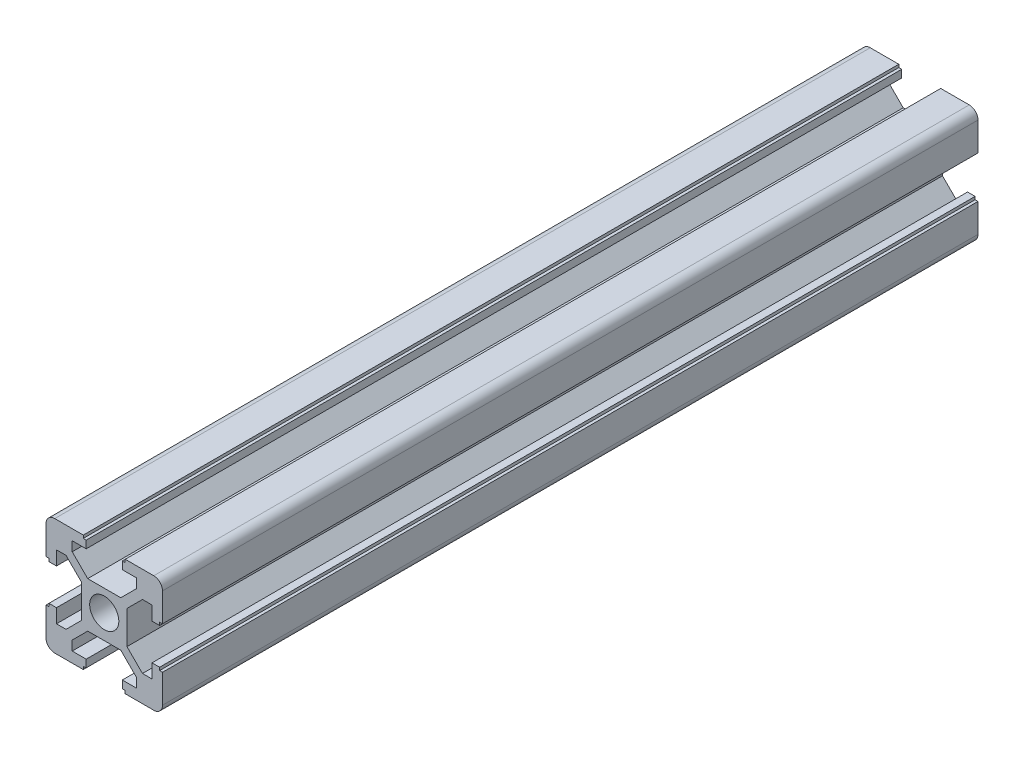
from build123d import *

# Parameters (mm, degrees)
SKETCH1_R           = 2.5
BOSS_EXTRUDE1_DEPTH = 140
SCALE_2_SCALE       = 3
SCALE_3_SCALE       = 6
SCALE_5_SCALE       = 2
SCALE_6_SCALE       = 0.25
SCALE_7_SCALE       = 0.125
SCALE_8_SCALE       = 0.25
SCALE_9_SCALE       = 4
SCALE_10_SCALE      = 4
OTHER_START         = -17.55
OTHER_1_OUTLINE_R   = 5
OTHER_1_DEPTH       = 10
SCALE_11_SCALE      = 0.111111111


# Read off the part's stored shape, not the designer's step: 孔1
with BuildPart() as part:
    # Sketch1 → Boss-Extrude1 (new body)
    with BuildSketch(Plane.XY):
        with BuildLine():
            Line((2.839339828, 3.9), (5.5, 6.560660172))
            Line((5.5, 6.560660172), (5.5, 8.2))
            Line((5.5, 8.2), (3.1, 8.2))
            Line((3.1, 8.2), (3.1, 9.5))
            Line((3.1, 9.5), (3.6, 9.5))
            Line((3.6, 9.5), (3.6, 10))
            Line((3.6, 10), (8.5, 10))
            ThreePointArc((8.5, 10), (9.560660172, 9.560660172), (10, 8.5))
            Line((10, 8.5), (10, 3.6))
            Line((10, 3.6), (9.5, 3.6))
            Line((9.5, 3.6), (9.5, 3.1))
            Line((9.5, 3.1), (8.2, 3.1))
            Line((8.2, 3.1), (8.2, 5.5))
            Line((8.2, 5.5), (6.560660172, 5.5))
            Line((6.560660172, 5.5), (3.9, 2.839339828))
            Line((3.9, 2.839339828), (3.9, -2.839339828))
            Line((3.9, -2.839339828), (6.560660172, -5.5))
            Line((6.560660172, -5.5), (8.2, -5.5))
            Line((8.2, -5.5), (8.2, -3.1))
            Line((8.2, -3.1), (9.5, -3.1))
            Line((9.5, -3.1), (9.5, -3.6))
            Line((9.5, -3.6), (10, -3.6))
            Line((10, -3.6), (10, -8.5))
            ThreePointArc((10, -8.5), (9.560660172, -9.560660172), (8.5, -10))
            Line((8.5, -10), (3.6, -10))
            Line((3.6, -10), (3.6, -9.5))
            Line((3.6, -9.5), (3.1, -9.5))
            Line((3.1, -9.5), (3.1, -8.2))
            Line((3.1, -8.2), (5.5, -8.2))
            Line((5.5, -8.2), (5.5, -6.560660172))
            Line((5.5, -6.560660172), (2.839339828, -3.9))
            Line((2.839339828, -3.9), (-2.839339828, -3.9))
            Line((-2.839339828, -3.9), (-5.5, -6.560660172))
            Line((-5.5, -6.560660172), (-5.5, -8.2))
            Line((-5.5, -8.2), (-3.1, -8.2))
            Line((-3.1, -8.2), (-3.1, -9.5))
            Line((-3.1, -9.5), (-3.6, -9.5))
            Line((-3.6, -9.5), (-3.6, -10))
            Line((-3.6, -10), (-8.5, -10))
            ThreePointArc((-8.5, -10), (-9.560660172, -9.560660172), (-10, -8.5))
            Line((-10, -8.5), (-10, -3.6))
            Line((-10, -3.6), (-9.5, -3.6))
            Line((-9.5, -3.6), (-9.5, -3.1))
            Line((-9.5, -3.1), (-8.2, -3.1))
            Line((-8.2, -3.1), (-8.2, -5.5))
            Line((-8.2, -5.5), (-6.560660172, -5.5))
            Line((-6.560660172, -5.5), (-3.9, -2.839339828))
            Line((-3.9, -2.839339828), (-3.9, 2.839339828))
            Line((-3.9, 2.839339828), (-6.560660172, 5.5))
            Line((-6.560660172, 5.5), (-8.2, 5.5))
            Line((-8.2, 5.5), (-8.2, 3.1))
            Line((-8.2, 3.1), (-9.5, 3.1))
            Line((-9.5, 3.1), (-9.5, 3.6))
            Line((-9.5, 3.6), (-10, 3.6))
            Line((-10, 3.6), (-10, 8.5))
            ThreePointArc((-10, 8.5), (-9.560660172, 9.560660172), (-8.5, 10))
            Line((-8.5, 10), (-3.6, 10))
            Line((-3.6, 10), (-3.6, 9.5))
            Line((-3.6, 9.5), (-3.1, 9.5))
            Line((-3.1, 9.5), (-3.1, 8.2))
            Line((-3.1, 8.2), (-5.5, 8.2))
            Line((-5.5, 8.2), (-5.5, 6.560660172))
            Line((-5.5, 6.560660172), (-2.839339828, 3.9))
            Line((-2.839339828, 3.9), (2.839339828, 3.9))
        make_face()
        with Locations((0, 0.235847297)):
            Circle(SKETCH1_R, mode=Mode.SUBTRACT)
    extrude(amount=BOSS_EXTRUDE1_DEPTH)


with BuildPart() as part_1:
    # 缩放比例2: scaled about (0, -0.027095247, 70)
    add(part.part.scale(SCALE_2_SCALE).moved(Location((0, 0.054190494, -140))))


with BuildPart() as part_2:
    # 缩放比例3: scaled about (0, -0.027095247, 70)
    add(part_1.part.scale(SCALE_3_SCALE).moved(Location((0, 0.135476235, -350))))


with BuildPart() as part_3:
    # 缩放比例5: scaled about (0, -0.027095249, 70)
    add(part_2.part.scale(SCALE_5_SCALE).moved(Location((0, 0.027095249, -70))))


with BuildPart() as part_4:
    # 缩放比例6: scaled about (0, -0.027095249, 70)
    add(part_3.part.scale(SCALE_6_SCALE).moved(Location((0, -0.020321437, 52.5))))


with BuildPart() as part_5:
    # 缩放比例7: scaled about (0, -0.027095249, 70)
    add(part_4.part.scale(SCALE_7_SCALE).moved(Location((0, -0.023708343, 61.25))))


with BuildPart() as part_6:
    # 缩放比例8: scaled about (0, -0.027095249, 70)
    add(part_5.part.scale(SCALE_8_SCALE).moved(Location((0, -0.020321437, 52.5))))


with BuildPart() as part_7:
    # 缩放比例9: scaled about (0, -0.027095249, 70)
    add(part_6.part.scale(SCALE_9_SCALE).moved(Location((0, 0.081285747, -210))))


with BuildPart() as part_8:
    # 缩放比例10: scaled about (0, -0.027095249, 70)
    add(part_7.part.scale(SCALE_10_SCALE).moved(Location((0, 0.081285747, -210))))

    # 孔1 outline → 孔1 (cut)
    with BuildSketch(Plane.YZ.offset(OTHER_START)):
        with Locations((7.344833538, 1.297306883)):
            Circle(OTHER_1_OUTLINE_R)
    extrude(amount=OTHER_1_DEPTH, mode=Mode.SUBTRACT)


with BuildPart() as part_9:
    # 缩放比例11: scaled about (0.003980467, -0.029415588, 70.020567574)
    add(part_8.part.scale(SCALE_11_SCALE).moved(Location((0.003538193, -0.026147189, 62.24050451))))


solid = part_9.part
